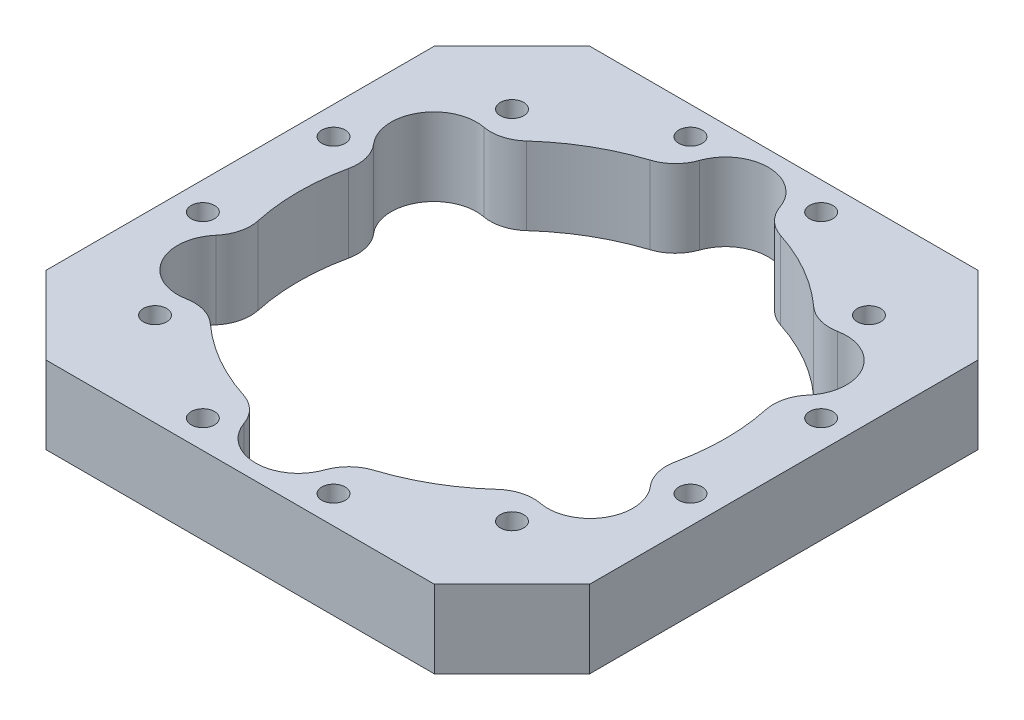
from build123d import *

# Parameters (mm, degrees)
SKETCH1_W           = 70
SKETCH1_H           = 70
SKETCH1_R           = 1.5
BOSS_EXTRUDE1_DEPTH = 10
FILLET1_R           = 5
CHAMFER1_SIZE       = 10


with BuildPart() as part:
    # Sketch1 → Boss-Extrude1 (new body)
    with BuildSketch(Plane(origin=(0, 0, 0), x_dir=(1, 0, 0), z_dir=(0, 1, 0))):
        Rectangle(SKETCH1_W, SKETCH1_H)
        with Locations((-22.980970389, -22.980970389)):
            Circle(SKETCH1_R, mode=Mode.SUBTRACT)
        with Locations((-8.411618966, -31.392589354)):
            Circle(SKETCH1_R, mode=Mode.SUBTRACT)
        with Locations((-31.392589354, -8.411618966)):
            Circle(SKETCH1_R, mode=Mode.SUBTRACT)
        with Locations((8.411618966, -31.392589354)):
            Circle(SKETCH1_R, mode=Mode.SUBTRACT)
        with Locations((22.980970389, -22.980970389)):
            Circle(SKETCH1_R, mode=Mode.SUBTRACT)
        with Locations((31.392589354, -8.411618966)):
            Circle(SKETCH1_R, mode=Mode.SUBTRACT)
        with Locations((-31.392589354, 8.411618966)):
            Circle(SKETCH1_R, mode=Mode.SUBTRACT)
        with Locations((-22.980970389, 22.980970389)):
            Circle(SKETCH1_R, mode=Mode.SUBTRACT)
        with Locations((-8.411618966, 31.392589354)):
            Circle(SKETCH1_R, mode=Mode.SUBTRACT)
        with BuildLine():
            ThreePointArc((26.075600084, 8.735735817), (27.141564088, 4.425550683), (27.5, 0))
            ThreePointArc((27.5, 0), (27.141564088, -4.425550683), (26.075600084, -8.735735817))
            ThreePointArc((26.075600084, -8.735735817), (28.435193064, -10.764992307), (29.315698604, -13.75))
            ThreePointArc((29.315698604, -13.75), (26.323794313, -18.644839723), (20.60316918, -18.214264183))
            ThreePointArc((20.60316918, -18.214264183), (13.75, -23.815698604), (5.472430904, -26.95))
            ThreePointArc((5.472430904, -26.95), (5.493103402, -27.224654737), (5.5, -27.5))
            ThreePointArc((5.5, -27.5), (-0.275345263, -32.993103402), (-5.472430904, -26.95))
            ThreePointArc((-5.472430904, -26.95), (-13.75, -23.815698604), (-20.60316918, -18.214264183))
            ThreePointArc((-20.60316918, -18.214264183), (-28.578838325, -16.5), (-26.075600084, -8.735735817))
            ThreePointArc((-26.075600084, -8.735735817), (-27.5, 0), (-26.075600084, 8.735735817))
            ThreePointArc((-26.075600084, 8.735735817), (-28.578838325, 16.5), (-20.60316918, 18.214264183))
            ThreePointArc((-20.60316918, 18.214264183), (-13.75, 23.815698604), (-5.472430904, 26.95))
            ThreePointArc((-5.472430904, 26.95), (-0.275345263, 32.993103402), (5.5, 27.5))
            ThreePointArc((5.5, 27.5), (5.493103402, 27.224654737), (5.472430904, 26.95))
            ThreePointArc((5.472430904, 26.95), (13.75, 23.815698604), (20.60316918, 18.214264183))
            ThreePointArc((20.60316918, 18.214264183), (26.323794313, 18.644839723), (29.315698604, 13.75))
            ThreePointArc((29.315698604, 13.75), (28.435193064, 10.764992307), (26.075600084, 8.735735817))
        make_face(mode=Mode.SUBTRACT)
        with Locations((31.392589354, 8.411618966)):
            Circle(SKETCH1_R, mode=Mode.SUBTRACT)
        with Locations((8.411618966, 31.392589354)):
            Circle(SKETCH1_R, mode=Mode.SUBTRACT)
        with Locations((22.980970389, 22.980970389)):
            Circle(SKETCH1_R, mode=Mode.SUBTRACT)
    extrude(amount=BOSS_EXTRUDE1_DEPTH)

    # Fillet1
    fillet1_edges = [part.edges().sort_by_distance(p)[0] for p in [
        (5.472430904, 5, -26.95),
        (20.60316918, 5, -18.214264183),
        (26.075600084, 5, 8.735735817),
        (26.075600084, 5, -8.735735817),
        (20.60316918, 5, 18.214264183),
        (5.472430904, 5, 26.95),
        (-5.472430904, 5, 26.95),
        (-20.60316918, 5, 18.214264183),
        (-26.075600084, 5, 8.735735817),
        (-26.075600084, 5, -8.735735817),
        (-20.60316918, 5, -18.214264183),
        (-5.472430904, 5, -26.95),
    ]]
    fillet(fillet1_edges, radius=FILLET1_R)

    # Chamfer1
    chamfer1_edges = [part.edges().sort_by_distance(p)[0] for p in [
        (-35, 5, 35),
        (35, 5, 35),
        (35, 5, -35),
        (-35, 5, -35),
    ]]
    chamfer(chamfer1_edges, length=CHAMFER1_SIZE)


solid = part.part
